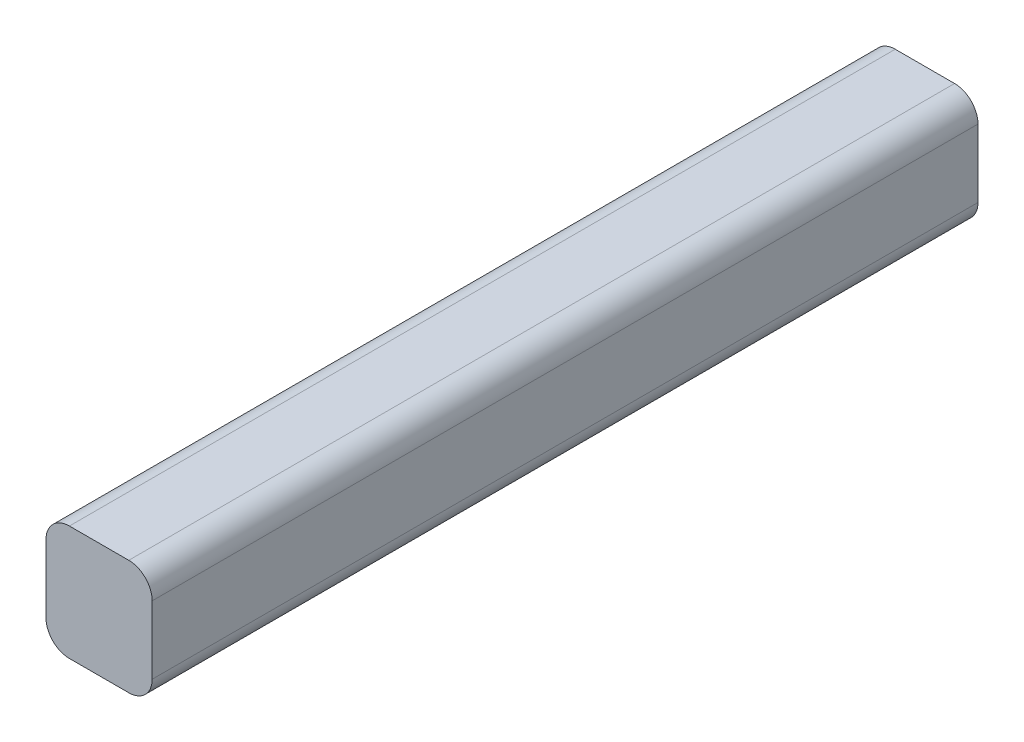
from build123d import *

# Parameters (mm, degrees)
SKETCH1_W           = 42.17
SKETCH1_H           = 45.57
BOSS_EXTRUDE1_DEPTH = 328
FILLET1_R           = 9.3


with BuildPart() as part:
    # Sketch1 → Boss-Extrude1 (new body)
    with BuildSketch(Plane.XY):
        with Locations((1.695, -0.005)):
            Rectangle(SKETCH1_W, SKETCH1_H)
    extrude(amount=BOSS_EXTRUDE1_DEPTH)

    # Fillet1
    fillet1_edges = [part.edges().sort_by_distance(p)[0] for p in [
        (-19.39, -22.79, 164),
        (-19.39, 22.78, 164),
        (22.78, 22.78, 164),
        (22.78, -22.79, 164),
    ]]
    fillet(fillet1_edges, radius=FILLET1_R)


solid = part.part
